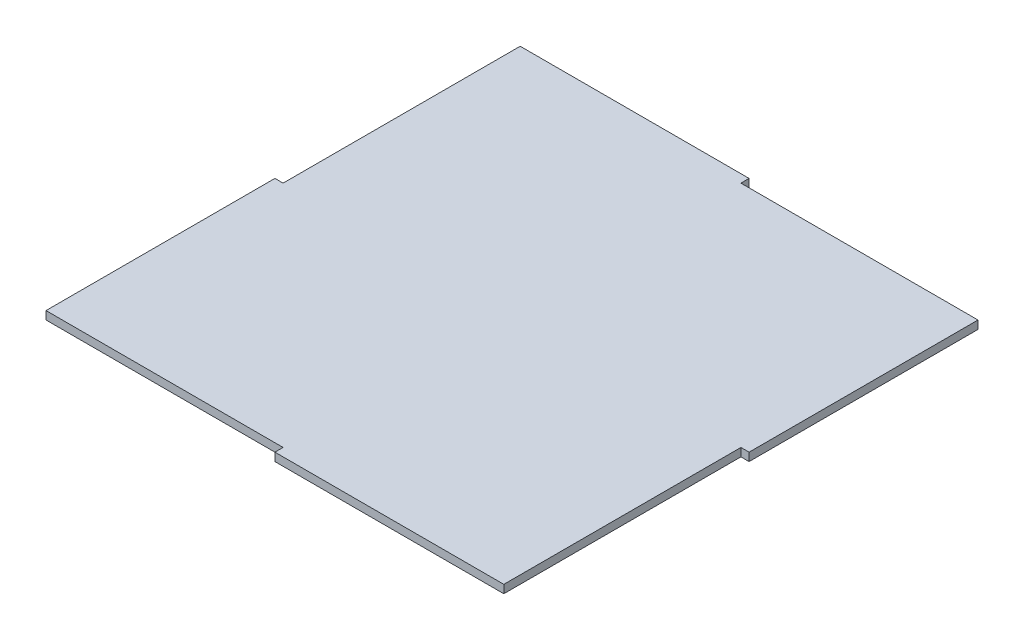
from build123d import *

# Parameters (mm, degrees)
BOSS_EXTRUDE1_DEPTH = 3.175


with BuildPart() as part:
    # Sketch1 → Boss-Extrude1 (new body)
    with BuildSketch(Plane(origin=(0, 0, 0), x_dir=(1, 0, 0), z_dir=(0, 1, 0))):
        Polygon((-112.506214689, 96.487711864), (-112.506214689, 4.412711864), (-115.681214689, 4.412711864), (-115.681214689, -84.487288136), (-23.606214689, -84.487288136), (-23.606214689, -87.662288136), (65.293785311, -87.662288136), (65.293785311, 4.412711864), (68.468785311, 4.412711864), (68.468785311, 93.312711864), (-23.606214689, 93.312711864), (-23.606214689, 96.487711864), align=None)
    extrude(amount=BOSS_EXTRUDE1_DEPTH)


solid = part.part
